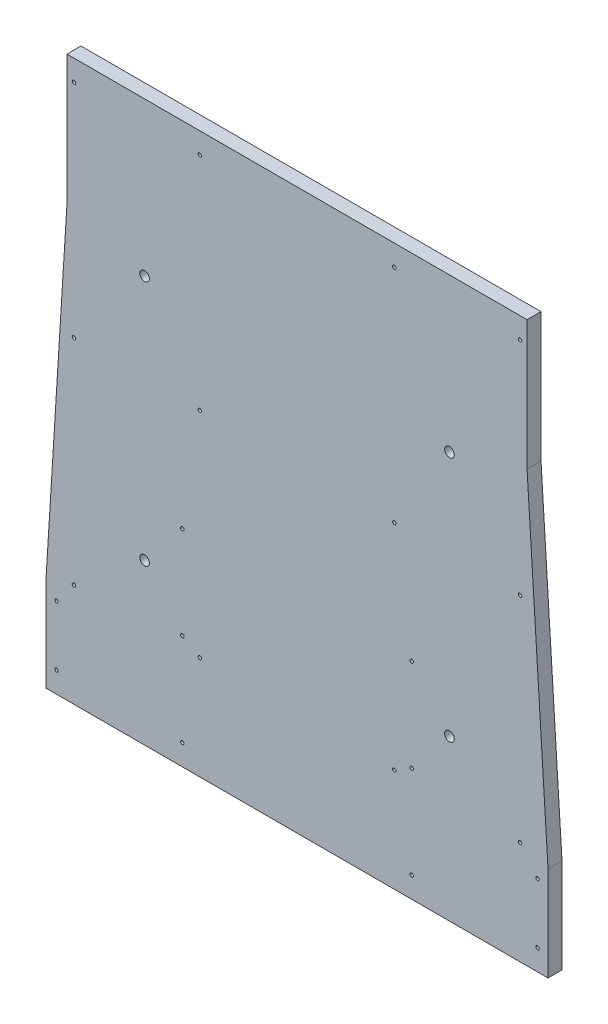
from build123d import *

# Parameters (mm, degrees)
SKETCH1_W                = 418.07892
SKETCH1_H                = 415.925
BOSS_EXTRUDE1_DEPTH      = 12.7
SKETCH2_W                = 418.07892
SKETCH2_H                = 79.68996
BOSS_EXTRUDE2_DEPTH      = 12.7
SKETCH3_W                = 418.07892
SKETCH3_H                = 28.376126504
BOSS_EXTRUDE3_DEPTH      = 12.7
BOSS_EXTRUDE4_DEPTH      = 12.7
CHAMFER1_SIZE            = 304.8
CHAMFER1_SIZE_2          = 19.05
SKETCH5_W                = 12.7
SKETCH5_H                = 15.453987587
CUT_EXTRUDE1_DEPTH       = 5568.603780331
F_5_16_CLEARANCE_HOLE1_D = 8.72998
HOLE1_D                  = 3.175
HOLE1_DEPTH              = 50.8
HOLE1_CSINK_D            = 10.16
HOLE1_CSINK_ANGLE        = 82
HOLE1_TIP                = 0.953866233


with BuildPart() as part:
    # Sketch1 → Boss-Extrude1 (new body)
    with BuildSketch(Plane.XY):
        with Locations((0, -5261.217030575)):
            Rectangle(SKETCH1_W, SKETCH1_H)
    extrude(amount=BOSS_EXTRUDE1_DEPTH)

    # Sketch2 → Boss-Extrude2 (add, through all)
    with BuildSketch(Plane(origin=(0, 0, 0), x_dir=(-1, 0, 0), z_dir=(0, 0, -1))):
        with Locations((0, -5509.024510575)):
            Rectangle(SKETCH2_W, SKETCH2_H)
    extrude(amount=-BOSS_EXTRUDE2_DEPTH)

    # Sketch3 → Boss-Extrude3 (add, through all)
    with BuildSketch(Plane(origin=(0, 0, 0), x_dir=(-1, 0, 0), z_dir=(0, 0, -1))):
        with Locations((0, -5039.066467323)):
            Rectangle(SKETCH3_W, SKETCH3_H)
    extrude(amount=-BOSS_EXTRUDE3_DEPTH)

    # Sketch4 → Boss-Extrude4 (add, through all)
    with BuildSketch(Plane(origin=(0, 0, 0), x_dir=(-1, 0, 0), z_dir=(0, 0, -1))):
        Polygon((209.038766336, -5447.352766987), (228.088766336, -5447.352766987), (228.088766336, -5548.869490575), (209.03946, -5548.869490575), align=None)
        Polygon((-209.03946, -5548.869490575), (-209.038766336, -5447.352766987), (-228.088766336, -5447.352766987), (-228.088766336, -5548.869490575), align=None)
    extrude(amount=-BOSS_EXTRUDE4_DEPTH)

    # Chamfer1
    # the kernel refuses this chamfer: 304.8, 19.05 mm, written as the material it adds along each edge
    with BuildSketch(Plane(origin=(-209.03946, -5447.352766987, 0), x_dir=(0.002399337658707147, 0.9999971215852571, 0), z_dir=(0, 0, 1))) as chamfer1_piece_1_section:
        Polygon((CHAMFER1_SIZE * 0.999997121585, CHAMFER1_SIZE * 0.00239933765871), (-CHAMFER1_SIZE_2 * 0.00239933765871, CHAMFER1_SIZE_2 * 0.999997121585), (0, 0), align=None)
    chamfer1_piece_1 = extrude(amount=12.7, mode=Mode.PRIVATE)
    chamfer1_piece_1 = split(chamfer1_piece_1, bisect_by=Plane(origin=(-228.088766336, -5325.682018196, 6.35), z_dir=(1, 0, 0)), keep=Keep.TOP, mode=Mode.PRIVATE)
    add(chamfer1_piece_1)
    with BuildSketch(Plane(origin=(209.03946, -5447.352766987, 0), x_dir=(0.8520963193143735, -0.5233850041899339, 0), z_dir=(0, 0, 1))) as chamfer1_piece_2_section:
        Polygon((CHAMFER1_SIZE_2 * 0.852096319314, CHAMFER1_SIZE_2 * 0.52338500419), (-CHAMFER1_SIZE * 0.52338500419, CHAMFER1_SIZE * 0.852096319314), (0, 0), align=None)
    chamfer1_piece_2 = extrude(amount=12.7, mode=Mode.PRIVATE)
    chamfer1_piece_2 = split(chamfer1_piece_2, bisect_by=Plane(origin=(228.088766336, -5325.682018196, 6.35), z_dir=(-1, 0, 0)), keep=Keep.TOP, mode=Mode.PRIVATE)
    add(chamfer1_piece_2)

    # Sketch5 → Cut-Extrude1 (cut, through all)
    with BuildSketch(Plane(origin=(228.088766336, 0, 0), x_dir=(0, 0, -1), z_dir=(1, 0, 0))):
        with Locations((-6.35, -5541.142496782)):
            Rectangle(SKETCH5_W, SKETCH5_H)
    extrude(amount=-CUT_EXTRUDE1_DEPTH, mode=Mode.SUBTRACT)

    # 5/16 Clearance Hole1 (through all)
    with Locations(Plane(origin=(0, 0, 0), x_dir=(-1, 0, 0), z_dir=(0, 0, -1))):
        with Locations((138.550999994, -5387.96381451), (-138.550999994, -5387.96381451), (-138.550999994, -5164.31681451), (138.550999994, -5164.31681451)):
            Hole(F_5_16_CLEARANCE_HOLE1_D / 2)

    # Hole1
    with Locations(Plane(origin=(0, -5562.870276207, -19.05), x_dir=(-1, 0, 0), z_dir=(0, 0, -1))):
        with Locations((218.563766336, 102.817509219), (218.563766336, 48.504773219), (202.68946, 123.306744588), (202.68946, 317.949308361), (202.68946, 518.941872135), (88.38946, 518.941872135), (88.38946, 317.949308361), (88.38946, 123.306744588), (104.263766336, 216.849631358), (104.263766336, 132.677202288), (104.263766336, 48.504773219), (-104.263766336, 48.504773219), (-104.263766336, 132.677202288), (-104.263766336, 216.849631358), (-88.38946, 123.306744588), (-88.38946, 317.949308361), (-88.38946, 518.941872135), (-202.68946, 518.941872135), (-202.68946, 317.949308361), (-202.68946, 123.306744588), (-218.563766336, 48.504773219), (-218.563766336, 102.817509219)):
            CounterSinkHole(HOLE1_D / 2, HOLE1_CSINK_D / 2, depth=HOLE1_DEPTH, counter_sink_angle=HOLE1_CSINK_ANGLE)
            with Locations((0, 0, -(HOLE1_DEPTH + HOLE1_TIP / 2))):  # 118° drill point
                Cone(0, HOLE1_D / 2, HOLE1_TIP, mode=Mode.SUBTRACT)


solid = part.part
